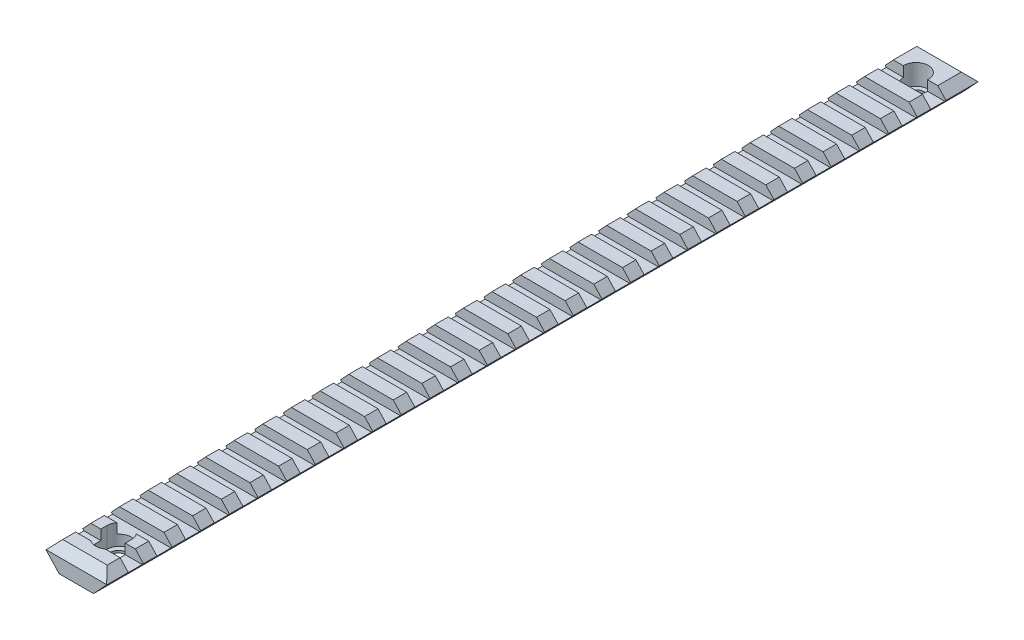
from build123d import *
from OCP.BRepFilletAPI import BRepFilletAPI_MakeChamfer

# Parameters (mm, degrees)
BOSS_EXTRUDE1_DEPTH                                 = 17.499999999999957
SKETCH2_W                                           = 2.440625000198204
SKETCH2_H                                           = 17.499999999999943
BOSS_EXTRUDE2_DEPTH                                 = 5.379194630286068
BOSS_EXTRUDE3_DEPTH                                 = 286.5
SKETCH4_W                                           = 304
SKETCH4_H                                           = 7.9999999999390115
BOSS_EXTRUDE4_DEPTH                                 = 17.940625001
CUT_EXTRUDE1_DEPTH                                  = 17.49999999999996
CUT_EXTRUDE2_DEPTH                                  = 2.6208053713139314
CUT_EXTRUDE3_DEPTH                                  = 0.8791946285937784
CUT_EXTRUDE4_DEPTH                                  = 3.7000000004
CUT_EXTRUDE5_DEPTH                                  = 10.950000000435777
CUT_EXTRUDE6_DEPTH                                  = 1.849999999182561
CUT_EXTRUDE7_DEPTH                                  = 1.8499999995642005
BOSS_EXTRUDE5_START                                 = 3.4999999996
BOSS_EXTRUDE5_DEPTH                                 = 3.4999999996
BOSS_EXTRUDE6_DEPTH                                 = 3.499999999200001
SKETCH14_W                                          = 5.300000000000011
SKETCH14_H                                          = 3.499999999999999
CUT_EXTRUDE8_DEPTH                                  = 305.78745930839824
SKETCH15_W                                          = 5.300000000000011
SKETCH15_H                                          = 3.499999999999999
CUT_EXTRUDE9_DEPTH                                  = 305.78745930839824
SKETCH16_W                                          = 5.300000000000011
SKETCH16_H                                          = 3.499999999999999
CUT_EXTRUDE10_DEPTH                                 = 305.78745930839824
SKETCH17_W                                          = 5.30000000000004
SKETCH17_H                                          = 3.499999999999999
CUT_EXTRUDE11_DEPTH                                 = 305.78745930839824
SKETCH18_W                                          = 5.30000000000004
SKETCH18_H                                          = 3.499999999999999
CUT_EXTRUDE12_DEPTH                                 = 305.78745930839824
SKETCH19_W                                          = 5.30000000000004
SKETCH19_H                                          = 3.499999999999999
CUT_EXTRUDE13_DEPTH                                 = 305.78745930839824
SKETCH20_W                                          = 5.300000000000068
SKETCH20_H                                          = 3.499999999999999
CUT_EXTRUDE14_DEPTH                                 = 305.78745930839824
SKETCH21_W                                          = 5.300000000000068
SKETCH21_H                                          = 3.499999999999999
CUT_EXTRUDE15_DEPTH                                 = 305.78745930839824
SKETCH22_W                                          = 5.30000000000004
SKETCH22_H                                          = 3.499999999999999
CUT_EXTRUDE16_DEPTH                                 = 305.78745930839824
SKETCH23_W                                          = 5.300000000000011
SKETCH23_H                                          = 3.499999999999999
CUT_EXTRUDE17_DEPTH                                 = 305.78745930839824
SKETCH24_W                                          = 5.300000000000011
SKETCH24_H                                          = 3.499999999999999
CUT_EXTRUDE18_DEPTH                                 = 305.78745930839824
SKETCH25_W                                          = 5.300000000000011
SKETCH25_H                                          = 3.499999999999999
CUT_EXTRUDE19_DEPTH                                 = 305.78745930839824
SKETCH26_W                                          = 5.300000000000011
SKETCH26_H                                          = 3.499999999999999
CUT_EXTRUDE20_DEPTH                                 = 305.78745930839824
SKETCH27_W                                          = 5.300000000000011
SKETCH27_H                                          = 3.499999999999999
CUT_EXTRUDE21_DEPTH                                 = 305.78745930839824
SKETCH28_W                                          = 5.300000000000011
SKETCH28_H                                          = 3.499999999999999
CUT_EXTRUDE22_DEPTH                                 = 305.78745930839824
SKETCH29_W                                          = 5.300000000000011
SKETCH29_H                                          = 3.499999999999999
CUT_EXTRUDE23_DEPTH                                 = 305.78745930839824
SKETCH30_W                                          = 5.300000000000011
SKETCH30_H                                          = 3.499999999999999
CUT_EXTRUDE24_DEPTH                                 = 305.78745930839824
SKETCH31_W                                          = 5.300000000000011
SKETCH31_H                                          = 3.499999999999999
CUT_EXTRUDE25_DEPTH                                 = 305.78745930839824
SKETCH32_W                                          = 5.299999999999997
SKETCH32_H                                          = 3.499999999999999
CUT_EXTRUDE26_DEPTH                                 = 305.78745930839824
SKETCH33_W                                          = 5.300000000000011
SKETCH33_H                                          = 3.499999999999999
CUT_EXTRUDE27_DEPTH                                 = 305.78745930839824
SKETCH34_W                                          = 5.299999999999997
SKETCH34_H                                          = 3.499999999999999
CUT_EXTRUDE28_DEPTH                                 = 305.78745930839824
SKETCH35_W                                          = 5.299999999999997
SKETCH35_H                                          = 3.499999999999999
CUT_EXTRUDE29_DEPTH                                 = 305.78745930839824
SKETCH36_W                                          = 5.300000000000004
SKETCH36_H                                          = 3.499999999999999
CUT_EXTRUDE30_DEPTH                                 = 305.78745930839824
SKETCH37_W                                          = 5.299999999999997
SKETCH37_H                                          = 3.499999999999999
CUT_EXTRUDE31_DEPTH                                 = 305.78745930839824
SKETCH38_W                                          = 5.300000000000004
SKETCH38_H                                          = 3.499999999999999
CUT_EXTRUDE32_DEPTH                                 = 305.78745930839824
SKETCH39_W                                          = 5.300000000000004
SKETCH39_H                                          = 3.499999999999999
CUT_EXTRUDE33_DEPTH                                 = 305.78745930839824
SKETCH40_W                                          = 5.300000000000001
SKETCH40_H                                          = 3.499999999999999
CUT_EXTRUDE34_DEPTH                                 = 305.78745930839824
CUT_EXTRUDE35_DEPTH                                 = 305.2559594123786
DRAFT1_ANGLE                                        = -42.96120536325627
CBORE_FOR_10_BINDING_HEAD_MACHINE_SCREW_D           = 5.5
CBORE_FOR_10_BINDING_HEAD_MACHINE_SCREW_CBORE_D     = 8.5
CBORE_FOR_10_BINDING_HEAD_MACHINE_SCREW_CBORE_DEPTH = 7.2
CHAMFER1_SIZE                                       = 4.181933117363962
CHAMFER1_SIZE2                                      = 5.700000000657957
CHAMFER2_SIZE                                       = 2.9999999999999987
CHAMFER3_SIZE                                       = 5.700000000657946
CHAMFER3_SIZE2                                      = 4.1819331173639664


with BuildPart() as part:
    # Sketch1 → Boss-Extrude1 (new body)
    with BuildSketch(Plane.XY.offset(304)):
        Polygon((-10.190625000198205, 5.379194630286068), (-7.75, 5.379194630286068), (-7.75, 7.999999999939011), align=None)
    extrude(amount=-BOSS_EXTRUDE1_DEPTH)

    # Sketch2 → Boss-Extrude2 (add)
    with BuildSketch(Plane.XZ.offset(-5.379194630286068)):
        with Locations((-8.970312500099103, 295.25)):
            Rectangle(SKETCH2_W, SKETCH2_H)
    extrude(amount=BOSS_EXTRUDE2_DEPTH)

    # Sketch3 → Boss-Extrude3 (add)
    with BuildSketch(Plane(origin=(0, 0, 286.50000000000006), x_dir=(-1, 0, 0), z_dir=(0, 0, -1))):
        Polygon((7.749999999999999, 8.000000000799998), (10.190625000198205, 8.000000000799998), (10.190625000198205, 0), (7.75, 0), align=None)
    extrude(amount=BOSS_EXTRUDE3_DEPTH)

    # Sketch4 → Boss-Extrude4 (add)
    with BuildSketch(Plane(origin=(-7.75, 0, 0), x_dir=(0, 0, -1), z_dir=(1, 0, 0))):
        with Locations((-152, 3.9999999999695057)):
            Rectangle(SKETCH4_W, SKETCH4_H)
    extrude(amount=BOSS_EXTRUDE4_DEPTH)

    # Sketch5 → Cut-Extrude1 (cut)
    with BuildSketch(Plane.XY.offset(304)):
        Polygon((10.190625001, 8), (7.75, 8), (10.190625001, 5.379194629425078), align=None)
    extrude(amount=-CUT_EXTRUDE1_DEPTH, mode=Mode.SUBTRACT)

    # Sketch6 → Cut-Extrude2 (cut)
    with BuildSketch(Plane(origin=(0, 8.000000000799998, 0), x_dir=(-1, 0, 0), z_dir=(0, 1, 0))):
        with BuildLine():
            Line((10.190625000198237, 286.49999999859995), (3.400000001041903, 286.49999999859995))
            ThreePointArc((3.400000001041903, 286.49999999859995), (4.031904017759586, 287.7060319930306), (4.250000001045995, 289.04999999860536))
            Line((4.250000001045995, 289.04999999860536), (4.250000001045996, 303.99999999860535))
            Line((4.250000001045996, 303.99999999860535), (-4.249999998953949, 303.99999999860535))
            Line((-4.249999998953949, 303.99999999860535), (-4.249999998953946, 289.04999999860536))
            ThreePointArc((-4.249999998953946, 289.04999999860536), (-4.031904015667556, 287.7060319930306), (-3.399999998949854, 286.49999999859995))
            Line((-3.399999998949854, 286.49999999859995), (-10.190625001, 286.49999999859995))
            Line((-10.190625001, 286.49999999859995), (-10.190625000999965, -1.40010309e-09))
            Line((-10.190625000999965, -1.40010309e-09), (10.190625000198237, -1.40010309e-09))
            Line((10.190625000198237, -1.40010309e-09), (10.190625000198237, 286.49999999859995))
        make_face()
    extrude(amount=-CUT_EXTRUDE2_DEPTH, mode=Mode.SUBTRACT)

    # Sketch7 → Cut-Extrude3 (cut)
    with BuildSketch(Plane(origin=(0, 5.379194629486068, 0), x_dir=(-1, 0, 0), z_dir=(0, 1, 0))):
        with BuildLine():
            Line((10.19062500051319, 286.4999999993), (3.400000000520938, 286.4999999993))
            ThreePointArc((3.400000000520938, 286.4999999993), (4.031904017237137, 287.70603199372954), (4.250000000522991, 289.0499999993027))
            Line((4.250000000522991, 289.0499999993027), (4.250000000522991, 303.99999999930264))
            Line((4.250000000522991, 303.99999999930264), (-4.249999999476969, 303.99999999930264))
            Line((-4.249999999476969, 303.99999999930264), (-4.249999999476968, 289.0499999993027))
            ThreePointArc((-4.249999999476968, 289.0499999993027), (-4.03190401619111, 287.70603199372954), (-3.3999999994749133, 286.4999999993))
            Line((-3.3999999994749133, 286.4999999993), (-10.190625000685047, 286.4999999993))
            Line((-10.190625000685047, 286.4999999993), (-10.190625000685014, -7.0005196e-10))
            Line((-10.190625000685014, -7.0005196e-10), (10.19062500051319, -7.0005196e-10))
            Line((10.19062500051319, -7.0005196e-10), (10.19062500051319, 286.4999999993))
        make_face()
    extrude(amount=-CUT_EXTRUDE3_DEPTH, mode=Mode.SUBTRACT)

    # Sketch8 → Cut-Extrude4 (cut)
    with BuildSketch(Plane(origin=(0, 4.50000000089229, 0), x_dir=(-1, 0, 0), z_dir=(0, 1, 0))):
        with BuildLine():
            Line((-4.2499999999999885, 293.05), (-4.25, 289.05))
            ThreePointArc((-4.25, 289.05), (-7.8e-16, 284.8), (4.250000000000002, 289.05))
            Line((4.250000000000002, 289.05), (4.250000000000002, 293.05))
            ThreePointArc((4.250000000000002, 293.05), (2.6e-16, 297.3), (-4.2499999999999885, 293.05))
        make_face()
    extrude(amount=-CUT_EXTRUDE4_DEPTH, mode=Mode.SUBTRACT)

    # Sketch9 → Cut-Extrude5 (cut)
    with BuildSketch(Plane.XY.offset(304)):
        Polygon((4.25, 8), (4.25, 4.500000000000001), (10.190625001, 4.500000000000001), (10.190625001, 5.379194629425078), (7.75, 8), align=None)
        Polygon((-4.25, 4.500000000000001), (-4.25, 8), (-7.75, 8), (-10.190625000198205, 5.379194630286068), (-10.190625000198205, 4.500000000000001), align=None)
    extrude(amount=-CUT_EXTRUDE5_DEPTH, mode=Mode.SUBTRACT)

    # Sketch10 → Cut-Extrude6 (cut)
    with BuildSketch(Plane.XY.offset(293.0499999995642)):
        Polygon((-4.25, 4.500000000000001), (-4.25, 8), (-7.75, 8), (-10.190625000198205, 5.379194630286068), (-10.190625000198205, 4.500000000000001), align=None)
    extrude(amount=-CUT_EXTRUDE6_DEPTH, mode=Mode.SUBTRACT)

    # Sketch11 → Cut-Extrude7 (cut)
    with BuildSketch(Plane.XY.offset(293.0499999995642)):
        Polygon((4.25, 8), (4.25, 4.5000000008), (10.190625001, 4.5000000008), (10.190625001, 5.379194629425078), (7.75, 8), align=None)
    extrude(amount=-CUT_EXTRUDE7_DEPTH, mode=Mode.SUBTRACT)

    # Sketch12 → Boss-Extrude5 (add)
    with BuildSketch(Plane(origin=(0, 4.50000000089229, 0), x_dir=(-1, 0, 0), z_dir=(0, 1, 0)).offset(BOSS_EXTRUDE5_START)):
        with BuildLine():
            Line((-2.481934729126057, 296.5000000000519), (-10.190625001, 296.5000000000519))
            Line((-10.190625001, 296.5000000000519), (-10.190625001, 304.0000000000519))
            Line((-10.190625001, 304.0000000000519), (10.190625000198205, 304.0000000000519))
            Line((10.190625000198205, 304.0000000000519), (10.190625000198205, 296.5000000000519))
            Line((10.190625000198205, 296.5000000000519), (2.481934729435837, 296.5000000000519))
            ThreePointArc((2.481934729435837, 296.5000000000519), (1.5489025e-10, 297.3000000001115), (-2.481934729126057, 296.5000000000519))
        make_face()
    extrude(amount=-BOSS_EXTRUDE5_DEPTH)

    # Sketch13 → Boss-Extrude6 (add)
    with BuildSketch(Plane(origin=(0, 4.50000000089229, 0), x_dir=(-1, 0, 0), z_dir=(0, 1, 0))):
        Polygon((10.190625000198205, 0), (-10.190625000999999, 0), (-10.190625001, 281.2), (10.190625000198205, 281.2), align=None)
    extrude(amount=BOSS_EXTRUDE6_DEPTH)

    # Sketch14 → Cut-Extrude8 (cut, through all)
    with BuildSketch(Plane(origin=(10.190625001, 0, 0), x_dir=(0, 0, -1), z_dir=(1, 0, 0))):
        with Locations((-273.85, 6.25)):
            Rectangle(SKETCH14_W, SKETCH14_H)
    extrude(amount=-CUT_EXTRUDE8_DEPTH, mode=Mode.SUBTRACT)

    # Sketch15 → Cut-Extrude9 (cut, through all)
    with BuildSketch(Plane(origin=(10.190625001, 0, 0), x_dir=(0, 0, -1), z_dir=(1, 0, 0))):
        with Locations((-263.85, 6.25)):
            Rectangle(SKETCH15_W, SKETCH15_H)
    extrude(amount=-CUT_EXTRUDE9_DEPTH, mode=Mode.SUBTRACT)

    # Sketch16 → Cut-Extrude10 (cut, through all)
    with BuildSketch(Plane(origin=(10.190625001, 0, 0), x_dir=(0, 0, -1), z_dir=(1, 0, 0))):
        with Locations((-253.85, 6.25)):
            Rectangle(SKETCH16_W, SKETCH16_H)
    extrude(amount=-CUT_EXTRUDE10_DEPTH, mode=Mode.SUBTRACT)

    # Sketch17 → Cut-Extrude11 (cut, through all)
    with BuildSketch(Plane(origin=(10.190625001, 0, 0), x_dir=(0, 0, -1), z_dir=(1, 0, 0))):
        with Locations((-243.85000000000002, 6.25)):
            Rectangle(SKETCH17_W, SKETCH17_H)
    extrude(amount=-CUT_EXTRUDE11_DEPTH, mode=Mode.SUBTRACT)

    # Sketch18 → Cut-Extrude12 (cut, through all)
    with BuildSketch(Plane(origin=(10.190625001, 0, 0), x_dir=(0, 0, -1), z_dir=(1, 0, 0))):
        with Locations((-233.85000000000002, 6.25)):
            Rectangle(SKETCH18_W, SKETCH18_H)
    extrude(amount=-CUT_EXTRUDE12_DEPTH, mode=Mode.SUBTRACT)

    # Sketch19 → Cut-Extrude13 (cut, through all)
    with BuildSketch(Plane(origin=(10.190625001, 0, 0), x_dir=(0, 0, -1), z_dir=(1, 0, 0))):
        with Locations((-223.85000000000002, 6.25)):
            Rectangle(SKETCH19_W, SKETCH19_H)
    extrude(amount=-CUT_EXTRUDE13_DEPTH, mode=Mode.SUBTRACT)

    # Sketch20 → Cut-Extrude14 (cut, through all)
    with BuildSketch(Plane(origin=(10.190625001, 0, 0), x_dir=(0, 0, -1), z_dir=(1, 0, 0))):
        with Locations((-213.85, 6.25)):
            Rectangle(SKETCH20_W, SKETCH20_H)
    extrude(amount=-CUT_EXTRUDE14_DEPTH, mode=Mode.SUBTRACT)

    # Sketch21 → Cut-Extrude15 (cut, through all)
    with BuildSketch(Plane(origin=(10.190625001, 0, 0), x_dir=(0, 0, -1), z_dir=(1, 0, 0))):
        with Locations((-203.85, 6.25)):
            Rectangle(SKETCH21_W, SKETCH21_H)
    extrude(amount=-CUT_EXTRUDE15_DEPTH, mode=Mode.SUBTRACT)

    # Sketch22 → Cut-Extrude16 (cut, through all)
    with BuildSketch(Plane(origin=(10.190625001, 0, 0), x_dir=(0, 0, -1), z_dir=(1, 0, 0))):
        with Locations((-193.84999999999997, 6.25)):
            Rectangle(SKETCH22_W, SKETCH22_H)
    extrude(amount=-CUT_EXTRUDE16_DEPTH, mode=Mode.SUBTRACT)

    # Sketch23 → Cut-Extrude17 (cut, through all)
    with BuildSketch(Plane(origin=(10.190625001, 0, 0), x_dir=(0, 0, -1), z_dir=(1, 0, 0))):
        with Locations((-183.85, 6.25)):
            Rectangle(SKETCH23_W, SKETCH23_H)
    extrude(amount=-CUT_EXTRUDE17_DEPTH, mode=Mode.SUBTRACT)

    # Sketch24 → Cut-Extrude18 (cut, through all)
    with BuildSketch(Plane(origin=(10.190625001, 0, 0), x_dir=(0, 0, -1), z_dir=(1, 0, 0))):
        with Locations((-173.85, 6.25)):
            Rectangle(SKETCH24_W, SKETCH24_H)
    extrude(amount=-CUT_EXTRUDE18_DEPTH, mode=Mode.SUBTRACT)

    # Sketch25 → Cut-Extrude19 (cut, through all)
    with BuildSketch(Plane(origin=(10.190625001, 0, 0), x_dir=(0, 0, -1), z_dir=(1, 0, 0))):
        with Locations((-163.85, 6.25)):
            Rectangle(SKETCH25_W, SKETCH25_H)
    extrude(amount=-CUT_EXTRUDE19_DEPTH, mode=Mode.SUBTRACT)

    # Sketch26 → Cut-Extrude20 (cut, through all)
    with BuildSketch(Plane(origin=(10.190625001, 0, 0), x_dir=(0, 0, -1), z_dir=(1, 0, 0))):
        with Locations((-153.85, 6.25)):
            Rectangle(SKETCH26_W, SKETCH26_H)
    extrude(amount=-CUT_EXTRUDE20_DEPTH, mode=Mode.SUBTRACT)

    # Sketch27 → Cut-Extrude21 (cut, through all)
    with BuildSketch(Plane(origin=(10.190625001, 0, 0), x_dir=(0, 0, -1), z_dir=(1, 0, 0))):
        with Locations((-143.85, 6.25)):
            Rectangle(SKETCH27_W, SKETCH27_H)
    extrude(amount=-CUT_EXTRUDE21_DEPTH, mode=Mode.SUBTRACT)

    # Sketch28 → Cut-Extrude22 (cut, through all)
    with BuildSketch(Plane(origin=(10.190625001, 0, 0), x_dir=(0, 0, -1), z_dir=(1, 0, 0))):
        with Locations((-133.85, 6.25)):
            Rectangle(SKETCH28_W, SKETCH28_H)
    extrude(amount=-CUT_EXTRUDE22_DEPTH, mode=Mode.SUBTRACT)

    # Sketch29 → Cut-Extrude23 (cut, through all)
    with BuildSketch(Plane(origin=(10.190625001, 0, 0), x_dir=(0, 0, -1), z_dir=(1, 0, 0))):
        with Locations((-123.85000000000001, 6.25)):
            Rectangle(SKETCH29_W, SKETCH29_H)
    extrude(amount=-CUT_EXTRUDE23_DEPTH, mode=Mode.SUBTRACT)

    # Sketch30 → Cut-Extrude24 (cut, through all)
    with BuildSketch(Plane(origin=(10.190625001, 0, 0), x_dir=(0, 0, -1), z_dir=(1, 0, 0))):
        with Locations((-113.85000000000001, 6.25)):
            Rectangle(SKETCH30_W, SKETCH30_H)
    extrude(amount=-CUT_EXTRUDE24_DEPTH, mode=Mode.SUBTRACT)

    # Sketch31 → Cut-Extrude25 (cut, through all)
    with BuildSketch(Plane(origin=(10.190625001, 0, 0), x_dir=(0, 0, -1), z_dir=(1, 0, 0))):
        with Locations((-103.85000000000001, 6.25)):
            Rectangle(SKETCH31_W, SKETCH31_H)
    extrude(amount=-CUT_EXTRUDE25_DEPTH, mode=Mode.SUBTRACT)

    # Sketch32 → Cut-Extrude26 (cut, through all)
    with BuildSketch(Plane(origin=(10.190625001, 0, 0), x_dir=(0, 0, -1), z_dir=(1, 0, 0))):
        with Locations((-93.85, 6.25)):
            Rectangle(SKETCH32_W, SKETCH32_H)
    extrude(amount=-CUT_EXTRUDE26_DEPTH, mode=Mode.SUBTRACT)

    # Sketch33 → Cut-Extrude27 (cut, through all)
    with BuildSketch(Plane(origin=(10.190625001, 0, 0), x_dir=(0, 0, -1), z_dir=(1, 0, 0))):
        with Locations((-83.85000000000001, 6.25)):
            Rectangle(SKETCH33_W, SKETCH33_H)
    extrude(amount=-CUT_EXTRUDE27_DEPTH, mode=Mode.SUBTRACT)

    # Sketch34 → Cut-Extrude28 (cut, through all)
    with BuildSketch(Plane(origin=(10.190625001, 0, 0), x_dir=(0, 0, -1), z_dir=(1, 0, 0))):
        with Locations((-73.85, 6.25)):
            Rectangle(SKETCH34_W, SKETCH34_H)
    extrude(amount=-CUT_EXTRUDE28_DEPTH, mode=Mode.SUBTRACT)

    # Sketch35 → Cut-Extrude29 (cut, through all)
    with BuildSketch(Plane(origin=(10.190625001, 0, 0), x_dir=(0, 0, -1), z_dir=(1, 0, 0))):
        with Locations((-63.85, 6.25)):
            Rectangle(SKETCH35_W, SKETCH35_H)
    extrude(amount=-CUT_EXTRUDE29_DEPTH, mode=Mode.SUBTRACT)

    # Sketch36 → Cut-Extrude30 (cut, through all)
    with BuildSketch(Plane(origin=(10.190625001, 0, 0), x_dir=(0, 0, -1), z_dir=(1, 0, 0))):
        with Locations((-53.85000000000001, 6.25)):
            Rectangle(SKETCH36_W, SKETCH36_H)
    extrude(amount=-CUT_EXTRUDE30_DEPTH, mode=Mode.SUBTRACT)

    # Sketch37 → Cut-Extrude31 (cut, through all)
    with BuildSketch(Plane(origin=(10.190625001, 0, 0), x_dir=(0, 0, -1), z_dir=(1, 0, 0))):
        with Locations((-43.85, 6.25)):
            Rectangle(SKETCH37_W, SKETCH37_H)
    extrude(amount=-CUT_EXTRUDE31_DEPTH, mode=Mode.SUBTRACT)

    # Sketch38 → Cut-Extrude32 (cut, through all)
    with BuildSketch(Plane(origin=(10.190625001, 0, 0), x_dir=(0, 0, -1), z_dir=(1, 0, 0))):
        with Locations((-33.849999999999994, 6.25)):
            Rectangle(SKETCH38_W, SKETCH38_H)
    extrude(amount=-CUT_EXTRUDE32_DEPTH, mode=Mode.SUBTRACT)

    # Sketch39 → Cut-Extrude33 (cut, through all)
    with BuildSketch(Plane(origin=(10.190625001, 0, 0), x_dir=(0, 0, -1), z_dir=(1, 0, 0))):
        with Locations((-23.85, 6.25)):
            Rectangle(SKETCH39_W, SKETCH39_H)
    extrude(amount=-CUT_EXTRUDE33_DEPTH, mode=Mode.SUBTRACT)

    # Sketch40 → Cut-Extrude34 (cut, through all)
    with BuildSketch(Plane(origin=(10.190625001, 0, 0), x_dir=(0, 0, -1), z_dir=(1, 0, 0))):
        with Locations((-13.85, 6.25)):
            Rectangle(SKETCH40_W, SKETCH40_H)
    extrude(amount=-CUT_EXTRUDE34_DEPTH, mode=Mode.SUBTRACT)

    # Sketch41 → Cut-Extrude35 (cut, through all)
    with BuildSketch(Plane(origin=(0, 0.8000000004922893, 0), x_dir=(-1, 0, 0), z_dir=(0, 1, 0))):
        with BuildLine():
            Line((-2.750000000999988, 292.75), (-2.7500000010000005, 289.3500000000001))
            ThreePointArc((-2.7500000010000005, 289.3500000000001), (-5.1e-16, 286.5999999990001), (2.7500000009999996, 289.3500000000001))
            Line((2.7500000009999996, 289.3500000000001), (2.7500000009999996, 292.75))
            ThreePointArc((2.7500000009999996, 292.75), (1.7e-16, 295.500000001), (-2.750000000999988, 292.75))
        make_face()
    extrude(amount=-CUT_EXTRUDE35_DEPTH, mode=Mode.SUBTRACT)

    # Draft1
    draft1_faces = [part.faces().sort_by_distance(p)[0] for p in [
        (10.190625001, 3.3391634726101462, 150.57530397364383),
        (-10.190625000198205, 3.3391634730259527, 150.5753039723901),
    ]]
    draft(draft1_faces, Plane(origin=(-5.2301219e-10, 4.50000000089229, 289.0499999993027), x_dir=(0, 0, 1), z_dir=(0, 1, 0)), DRAFT1_ANGLE)

    # CBORE for #10 Binding Head Machine Screw1 (through all)
    with Locations(Plane(origin=(0, 8.00000000009229, 0), x_dir=(1, 0, 0), z_dir=(0, 1, 0))):
        with Locations((0, -11)):
            CounterBoreHole(CBORE_FOR_10_BINDING_HEAD_MACHINE_SCREW_D / 2, CBORE_FOR_10_BINDING_HEAD_MACHINE_SCREW_CBORE_D / 2, CBORE_FOR_10_BINDING_HEAD_MACHINE_SCREW_CBORE_DEPTH)

    # Chamfer1: one chamfer whose edges measure the first distance from different faces: ONE call of the kernel's chamfer builder (chamfer() names one face for all edges)
    chamfer1_edges_1 = [part.edges().sort_by_distance(p)[0] for p in [
        (13.450000000542829, 8.00000000009229, 258.85),
        (13.450000000542829, 8.00000000009229, 98.85),
        (13.450000000542829, 8.00000000009229, 178.85),
        (13.450000000542829, 8.00000000009229, 18.849999999999994),
        (13.450000000542829, 8.00000000009229, 218.85),
        (13.450000000542829, 8.00000000009229, 138.85),
        (13.450000000542829, 8.00000000009229, 58.849999999999994),
        (13.450000000915326, 8.000000000492289, 300.2500000000259),
        (13.450000000542829, 8.00000000009229, 238.85000000000002),
        (13.450000000542829, 8.00000000009229, 198.85),
        (13.450000000542829, 8.00000000009229, 158.85),
        (13.450000000542829, 8.00000000009229, 118.85),
        (13.450000000542829, 8.00000000009229, 78.85),
        (13.450000000542829, 8.00000000009229, 38.849999999999994),
        (13.450000000542829, 8.00000000009229, 268.85),
        (13.450000000542829, 8.00000000009229, 248.85),
        (13.450000000542829, 8.00000000009229, 228.85),
        (13.450000000542829, 8.00000000009229, 208.85000000000002),
        (13.450000000542829, 8.00000000009229, 188.85),
        (13.450000000542829, 8.00000000009229, 168.85),
        (13.450000000542829, 8.00000000009229, 148.85),
        (13.450000000542829, 8.00000000009229, 128.85),
        (13.450000000542829, 8.00000000009229, 108.85),
        (13.450000000542829, 8.00000000009229, 88.85000000000001),
        (13.450000000542829, 8.00000000009229, 68.85),
        (13.450000000542829, 8.00000000009229, 48.849999999999994),
        (13.450000000542829, 8.00000000009229, 28.849999999999994),
        (13.450000000542829, 8.00000000009229, 278.85),
    ]]
    chamfer1_side_1 = [part.faces().sort_by_distance(p)[0] for p in [
        (9.107732758961262, 3.3371626941077412, 150.4233140175323),
    ]]
    chamfer1_edges_2 = [part.edges().sort_by_distance(p)[0] for p in [
        (-13.449999999741031, 8.000000000092289, 5.600000000000023),
    ]]
    chamfer1_side_2 = [part.faces().sort_by_distance(p)[0] for p in [
        (-9.10773275816121, 3.3371626941096157, 150.4233140176957),
    ]]
    chamfer1 = BRepFilletAPI_MakeChamfer(part.part.solid().wrapped)
    for e in chamfer1_edges_1:
        chamfer1.Add(CHAMFER1_SIZE, CHAMFER1_SIZE2, e.wrapped, chamfer1_side_1[0].wrapped)  # the first distance lies on this face
    for e in chamfer1_edges_2:
        chamfer1.Add(CHAMFER1_SIZE, CHAMFER1_SIZE2, e.wrapped, chamfer1_side_2[0].wrapped)  # the first distance lies on this face
    add(Compound.cast(chamfer1.Shape()), mode=Mode.REPLACE)

    # Chamfer2
    chamfer2_edges = [part.edges().sort_by_distance(p)[0] for p in [
        (-2.8499999999280785, 8.000000000492289, 304.0000000000519),
        (2.85000000072988, 8.00000000009229, 0),
    ]]
    chamfer(chamfer2_edges, length=CHAMFER2_SIZE)

    # Chamfer3: one chamfer whose edges measure the first distance from different faces: ONE call of the kernel's chamfer builder (chamfer() names one face for all edges)
    chamfer3_edges_1 = [part.edges().sort_by_distance(p)[0] for p in [
        (-13.449999999741031, 8.000000000092289, 18.849999999999994),
    ]]
    chamfer3_side_1 = [part.faces().sort_by_distance(p)[0] for p in [
        (-2.8499999999280803, 8.00000000009229, 18.85),
    ]]
    chamfer3_edges_2 = [part.edges().sort_by_distance(p)[0] for p in [
        (-13.449999999741031, 8.000000000092289, 28.849999999999994),
    ]]
    chamfer3_side_2 = [part.faces().sort_by_distance(p)[0] for p in [
        (-2.8499999999280803, 8.00000000009229, 28.85),
    ]]
    chamfer3_edges_3 = [part.edges().sort_by_distance(p)[0] for p in [
        (-13.449999999741031, 8.000000000092289, 38.849999999999994),
    ]]
    chamfer3_side_3 = [part.faces().sort_by_distance(p)[0] for p in [
        (-2.84999999992808, 8.00000000009229, 38.85),
    ]]
    chamfer3_edges_4 = [part.edges().sort_by_distance(p)[0] for p in [
        (-13.449999999741031, 8.000000000092289, 48.849999999999994),
    ]]
    chamfer3_side_4 = [part.faces().sort_by_distance(p)[0] for p in [
        (-2.8499999999280803, 8.00000000009229, 48.85),
    ]]
    chamfer3_edges_5 = [part.edges().sort_by_distance(p)[0] for p in [
        (-13.449999999741031, 8.000000000092289, 58.849999999999994),
    ]]
    chamfer3_side_5 = [part.faces().sort_by_distance(p)[0] for p in [
        (-2.8499999999280803, 8.00000000009229, 58.85),
    ]]
    chamfer3_edges_6 = [part.edges().sort_by_distance(p)[0] for p in [
        (-13.449999999741031, 8.000000000092289, 68.85),
    ]]
    chamfer3_side_6 = [part.faces().sort_by_distance(p)[0] for p in [
        (-2.84999999992808, 8.00000000009229, 68.85),
    ]]
    chamfer3_edges_7 = [part.edges().sort_by_distance(p)[0] for p in [
        (-13.449999999741031, 8.000000000092289, 78.85),
    ]]
    chamfer3_side_7 = [part.faces().sort_by_distance(p)[0] for p in [
        (-2.84999999992808, 8.00000000009229, 78.85),
    ]]
    chamfer3_edges_8 = [part.edges().sort_by_distance(p)[0] for p in [
        (-13.449999999741031, 8.000000000092289, 88.85),
    ]]
    chamfer3_side_8 = [part.faces().sort_by_distance(p)[0] for p in [
        (-2.8499999999280803, 8.00000000009229, 88.85),
    ]]
    chamfer3_edges_9 = [part.edges().sort_by_distance(p)[0] for p in [
        (-13.449999999741031, 8.000000000092289, 98.85),
    ]]
    chamfer3_side_9 = [part.faces().sort_by_distance(p)[0] for p in [
        (-2.8499999999280803, 8.00000000009229, 98.85000000000001),
    ]]
    chamfer3_edges_10 = [part.edges().sort_by_distance(p)[0] for p in [
        (-13.449999999741031, 8.000000000092289, 108.85),
    ]]
    chamfer3_side_10 = [part.faces().sort_by_distance(p)[0] for p in [
        (-2.84999999992808, 8.00000000009229, 108.85),
    ]]
    chamfer3_edges_11 = [part.edges().sort_by_distance(p)[0] for p in [
        (-13.449999999741031, 8.000000000092289, 118.85),
    ]]
    chamfer3_side_11 = [part.faces().sort_by_distance(p)[0] for p in [
        (-2.84999999992808, 8.00000000009229, 118.85),
    ]]
    chamfer3_edges_12 = [part.edges().sort_by_distance(p)[0] for p in [
        (-13.449999999741031, 8.000000000092289, 128.85),
    ]]
    chamfer3_side_12 = [part.faces().sort_by_distance(p)[0] for p in [
        (-2.8499999999280803, 8.00000000009229, 128.85),
    ]]
    chamfer3_edges_13 = [part.edges().sort_by_distance(p)[0] for p in [
        (-13.449999999741031, 8.000000000092289, 138.85),
    ]]
    chamfer3_side_13 = [part.faces().sort_by_distance(p)[0] for p in [
        (-2.8499999999280803, 8.00000000009229, 138.85),
    ]]
    chamfer3_edges_14 = [part.edges().sort_by_distance(p)[0] for p in [
        (-13.449999999741031, 8.000000000092289, 148.85),
    ]]
    chamfer3_side_14 = [part.faces().sort_by_distance(p)[0] for p in [
        (-2.84999999992808, 8.00000000009229, 148.85),
    ]]
    chamfer3_edges_15 = [part.edges().sort_by_distance(p)[0] for p in [
        (-13.449999999741031, 8.000000000092289, 158.85),
    ]]
    chamfer3_side_15 = [part.faces().sort_by_distance(p)[0] for p in [
        (-2.84999999992808, 8.00000000009229, 158.85),
    ]]
    chamfer3_edges_16 = [part.edges().sort_by_distance(p)[0] for p in [
        (-13.449999999741031, 8.000000000092289, 168.85),
    ]]
    chamfer3_side_16 = [part.faces().sort_by_distance(p)[0] for p in [
        (-2.8499999999280803, 8.00000000009229, 168.85),
    ]]
    chamfer3_edges_17 = [part.edges().sort_by_distance(p)[0] for p in [
        (-13.449999999741031, 8.000000000092289, 178.85),
    ]]
    chamfer3_side_17 = [part.faces().sort_by_distance(p)[0] for p in [
        (-2.8499999999280803, 8.00000000009229, 178.85),
    ]]
    chamfer3_edges_18 = [part.edges().sort_by_distance(p)[0] for p in [
        (-13.449999999741031, 8.000000000092289, 188.85),
    ]]
    chamfer3_side_18 = [part.faces().sort_by_distance(p)[0] for p in [
        (-2.84999999992808, 8.00000000009229, 188.85),
    ]]
    chamfer3_edges_19 = [part.edges().sort_by_distance(p)[0] for p in [
        (-13.449999999741031, 8.000000000092289, 198.85),
    ]]
    chamfer3_side_19 = [part.faces().sort_by_distance(p)[0] for p in [
        (-2.84999999992808, 8.00000000009229, 198.85),
    ]]
    chamfer3_edges_20 = [part.edges().sort_by_distance(p)[0] for p in [
        (-13.449999999741031, 8.000000000092289, 208.85000000000002),
    ]]
    chamfer3_side_20 = [part.faces().sort_by_distance(p)[0] for p in [
        (-2.8499999999280803, 8.00000000009229, 208.85000000000002),
    ]]
    chamfer3_edges_21 = [part.edges().sort_by_distance(p)[0] for p in [
        (-13.449999999741031, 8.000000000092289, 218.85),
    ]]
    chamfer3_side_21 = [part.faces().sort_by_distance(p)[0] for p in [
        (-2.8499999999280803, 8.00000000009229, 218.84999999999997),
    ]]
    chamfer3_edges_22 = [part.edges().sort_by_distance(p)[0] for p in [
        (-13.449999999741031, 8.000000000092289, 228.85),
    ]]
    chamfer3_side_22 = [part.faces().sort_by_distance(p)[0] for p in [
        (-2.84999999992808, 8.00000000009229, 228.85),
    ]]
    chamfer3_edges_23 = [part.edges().sort_by_distance(p)[0] for p in [
        (-13.449999999741031, 8.000000000092289, 238.85000000000002),
    ]]
    chamfer3_side_23 = [part.faces().sort_by_distance(p)[0] for p in [
        (-2.84999999992808, 8.00000000009229, 238.85000000000002),
    ]]
    chamfer3_edges_24 = [part.edges().sort_by_distance(p)[0] for p in [
        (-13.449999999741031, 8.000000000092289, 248.85),
    ]]
    chamfer3_side_24 = [part.faces().sort_by_distance(p)[0] for p in [
        (-2.8499999999280803, 8.00000000009229, 248.85),
    ]]
    chamfer3_edges_25 = [part.edges().sort_by_distance(p)[0] for p in [
        (-13.449999999741031, 8.000000000092289, 258.85),
    ]]
    chamfer3_side_25 = [part.faces().sort_by_distance(p)[0] for p in [
        (-2.8499999999280803, 8.00000000009229, 258.84999999999997),
    ]]
    chamfer3_edges_26 = [part.edges().sort_by_distance(p)[0] for p in [
        (-13.449999999741031, 8.000000000092289, 268.85),
    ]]
    chamfer3_side_26 = [part.faces().sort_by_distance(p)[0] for p in [
        (-2.84999999992808, 8.00000000009229, 268.84999999999997),
    ]]
    chamfer3_edges_27 = [part.edges().sort_by_distance(p)[0] for p in [
        (13.450000000542829, 8.00000000009229, 7.100000000000023),
    ]]
    chamfer3_side_27 = [part.faces().sort_by_distance(p)[0] for p in [
        (3.4461325887218637, 8.00000000009229, 6.639027436355077),
    ]]
    chamfer3_edges_28 = [part.edges().sort_by_distance(p)[0] for p in [
        (-13.449999999741031, 8.000000000092289, 278.85),
    ]]
    chamfer3_side_28 = [part.faces().sort_by_distance(p)[0] for p in [
        (-2.84999999992808, 8.00000000009229, 278.84999999999997),
    ]]
    chamfer3_edges_29 = [part.edges().sort_by_distance(p)[0] for p in [
        (-13.450000000113528, 8.000000000492289, 298.7500000000259),
    ]]
    chamfer3_side_29 = [part.faces().sort_by_distance(p)[0] for p in [
        (-2.933060915931703, 8.000000000492289, 298.8061686867129),
    ]]
    chamfer3 = BRepFilletAPI_MakeChamfer(part.part.solid().wrapped)
    for e in chamfer3_edges_1:
        chamfer3.Add(CHAMFER3_SIZE, CHAMFER3_SIZE2, e.wrapped, chamfer3_side_1[0].wrapped)  # the first distance lies on this face
    for e in chamfer3_edges_2:
        chamfer3.Add(CHAMFER3_SIZE, CHAMFER3_SIZE2, e.wrapped, chamfer3_side_2[0].wrapped)  # the first distance lies on this face
    for e in chamfer3_edges_3:
        chamfer3.Add(CHAMFER3_SIZE, CHAMFER3_SIZE2, e.wrapped, chamfer3_side_3[0].wrapped)  # the first distance lies on this face
    for e in chamfer3_edges_4:
        chamfer3.Add(CHAMFER3_SIZE, CHAMFER3_SIZE2, e.wrapped, chamfer3_side_4[0].wrapped)  # the first distance lies on this face
    for e in chamfer3_edges_5:
        chamfer3.Add(CHAMFER3_SIZE, CHAMFER3_SIZE2, e.wrapped, chamfer3_side_5[0].wrapped)  # the first distance lies on this face
    for e in chamfer3_edges_6:
        chamfer3.Add(CHAMFER3_SIZE, CHAMFER3_SIZE2, e.wrapped, chamfer3_side_6[0].wrapped)  # the first distance lies on this face
    for e in chamfer3_edges_7:
        chamfer3.Add(CHAMFER3_SIZE, CHAMFER3_SIZE2, e.wrapped, chamfer3_side_7[0].wrapped)  # the first distance lies on this face
    for e in chamfer3_edges_8:
        chamfer3.Add(CHAMFER3_SIZE, CHAMFER3_SIZE2, e.wrapped, chamfer3_side_8[0].wrapped)  # the first distance lies on this face
    for e in chamfer3_edges_9:
        chamfer3.Add(CHAMFER3_SIZE, CHAMFER3_SIZE2, e.wrapped, chamfer3_side_9[0].wrapped)  # the first distance lies on this face
    for e in chamfer3_edges_10:
        chamfer3.Add(CHAMFER3_SIZE, CHAMFER3_SIZE2, e.wrapped, chamfer3_side_10[0].wrapped)  # the first distance lies on this face
    for e in chamfer3_edges_11:
        chamfer3.Add(CHAMFER3_SIZE, CHAMFER3_SIZE2, e.wrapped, chamfer3_side_11[0].wrapped)  # the first distance lies on this face
    for e in chamfer3_edges_12:
        chamfer3.Add(CHAMFER3_SIZE, CHAMFER3_SIZE2, e.wrapped, chamfer3_side_12[0].wrapped)  # the first distance lies on this face
    for e in chamfer3_edges_13:
        chamfer3.Add(CHAMFER3_SIZE, CHAMFER3_SIZE2, e.wrapped, chamfer3_side_13[0].wrapped)  # the first distance lies on this face
    for e in chamfer3_edges_14:
        chamfer3.Add(CHAMFER3_SIZE, CHAMFER3_SIZE2, e.wrapped, chamfer3_side_14[0].wrapped)  # the first distance lies on this face
    for e in chamfer3_edges_15:
        chamfer3.Add(CHAMFER3_SIZE, CHAMFER3_SIZE2, e.wrapped, chamfer3_side_15[0].wrapped)  # the first distance lies on this face
    for e in chamfer3_edges_16:
        chamfer3.Add(CHAMFER3_SIZE, CHAMFER3_SIZE2, e.wrapped, chamfer3_side_16[0].wrapped)  # the first distance lies on this face
    for e in chamfer3_edges_17:
        chamfer3.Add(CHAMFER3_SIZE, CHAMFER3_SIZE2, e.wrapped, chamfer3_side_17[0].wrapped)  # the first distance lies on this face
    for e in chamfer3_edges_18:
        chamfer3.Add(CHAMFER3_SIZE, CHAMFER3_SIZE2, e.wrapped, chamfer3_side_18[0].wrapped)  # the first distance lies on this face
    for e in chamfer3_edges_19:
        chamfer3.Add(CHAMFER3_SIZE, CHAMFER3_SIZE2, e.wrapped, chamfer3_side_19[0].wrapped)  # the first distance lies on this face
    for e in chamfer3_edges_20:
        chamfer3.Add(CHAMFER3_SIZE, CHAMFER3_SIZE2, e.wrapped, chamfer3_side_20[0].wrapped)  # the first distance lies on this face
    for e in chamfer3_edges_21:
        chamfer3.Add(CHAMFER3_SIZE, CHAMFER3_SIZE2, e.wrapped, chamfer3_side_21[0].wrapped)  # the first distance lies on this face
    for e in chamfer3_edges_22:
        chamfer3.Add(CHAMFER3_SIZE, CHAMFER3_SIZE2, e.wrapped, chamfer3_side_22[0].wrapped)  # the first distance lies on this face
    for e in chamfer3_edges_23:
        chamfer3.Add(CHAMFER3_SIZE, CHAMFER3_SIZE2, e.wrapped, chamfer3_side_23[0].wrapped)  # the first distance lies on this face
    for e in chamfer3_edges_24:
        chamfer3.Add(CHAMFER3_SIZE, CHAMFER3_SIZE2, e.wrapped, chamfer3_side_24[0].wrapped)  # the first distance lies on this face
    for e in chamfer3_edges_25:
        chamfer3.Add(CHAMFER3_SIZE, CHAMFER3_SIZE2, e.wrapped, chamfer3_side_25[0].wrapped)  # the first distance lies on this face
    for e in chamfer3_edges_26:
        chamfer3.Add(CHAMFER3_SIZE, CHAMFER3_SIZE2, e.wrapped, chamfer3_side_26[0].wrapped)  # the first distance lies on this face
    for e in chamfer3_edges_27:
        chamfer3.Add(CHAMFER3_SIZE, CHAMFER3_SIZE2, e.wrapped, chamfer3_side_27[0].wrapped)  # the first distance lies on this face
    for e in chamfer3_edges_28:
        chamfer3.Add(CHAMFER3_SIZE, CHAMFER3_SIZE2, e.wrapped, chamfer3_side_28[0].wrapped)  # the first distance lies on this face
    for e in chamfer3_edges_29:
        chamfer3.Add(CHAMFER3_SIZE, CHAMFER3_SIZE2, e.wrapped, chamfer3_side_29[0].wrapped)  # the first distance lies on this face
    add(Compound.cast(chamfer3.Shape()), mode=Mode.REPLACE)


solid = part.part
